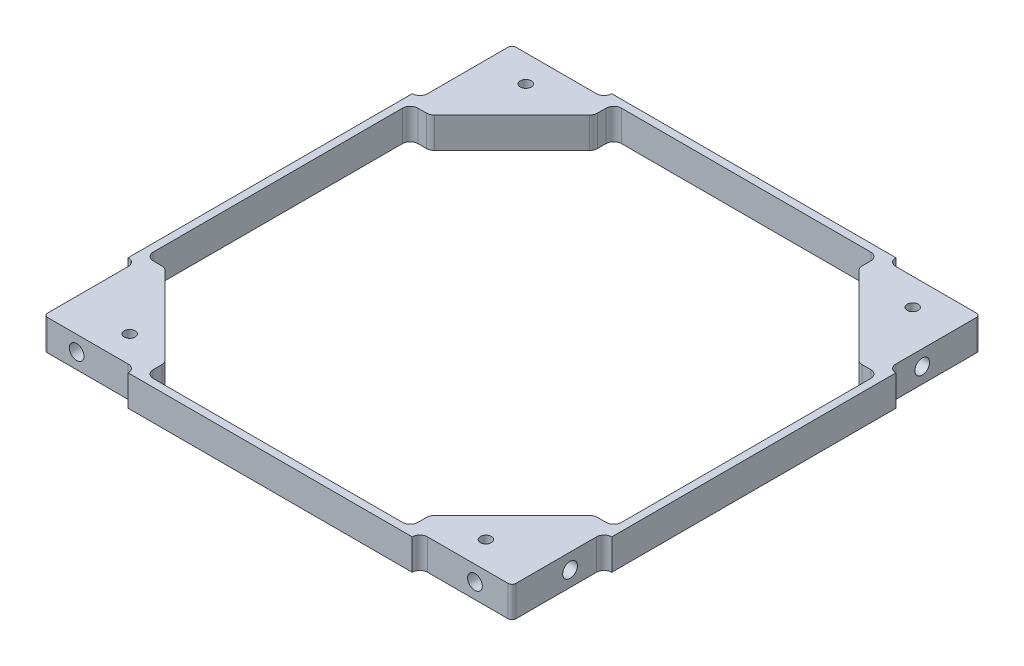
from build123d import *

# Parameters (mm, degrees)
BOSS_EXTRUDE2_DEPTH               = 6.35
FILLET7_R                         = 1.5875
FILLET8_R                         = 0.79
TAP_DRILL_FOR_4_HELICOIL5_D       = 3.048
TAP_DRILL_FOR_4_HELICOIL5_DEPTH   = 5.6896
TAP_DRILL_FOR_4_HELICOIL5_TIP     = 0.915711583
TAP_DRILL_FOR_4_HELICOIL5_2_D     = 3.048
TAP_DRILL_FOR_4_HELICOIL5_2_DEPTH = 5.6896
TAP_DRILL_FOR_4_HELICOIL5_2_TIP   = 0.915711583
FILLET10_R                        = 1.5875
TAP_DRILL_FOR_4_40_TAP1_D         = 2.2606
TAP_DRILL_FOR_4_40_TAP1_DEPTH     = 8.65
TAP_DRILL_FOR_4_40_TAP1_TIP       = 0.679152758
CHAMFER1_SIZE                     = 17
FILLET11_R                        = 1.5875
TAP_DRILL_FOR_4_HELICOIL6_D       = 3.048
TAP_DRILL_FOR_4_HELICOIL6_DEPTH   = 5.6896
TAP_DRILL_FOR_4_HELICOIL6_TIP     = 0.915711583
TAP_DRILL_FOR_4_HELICOIL7_D       = 3.048
TAP_DRILL_FOR_4_HELICOIL7_DEPTH   = 5.69
TAP_DRILL_FOR_4_HELICOIL7_TIP     = 0.915711583


with BuildPart() as part:
    # Sketch10 → Boss-Extrude2 (new body)
    with BuildSketch(Plane(origin=(0, 0, 0), x_dir=(1, 0, 0), z_dir=(0, 1, 0))):
        Polygon((48.415, -48.415), (29.365, -48.415), (29.365, -50), (-29.365, -50), (-29.365, -48.415), (-48.415, -48.415), (-48.415, -29.365), (-50, -29.365), (-50, 29.365), (-48.415, 29.365), (-48.415, 48.415), (-29.365, 48.415), (-29.365, 50), (29.365, 50), (29.365, 48.415), (48.415, 48.415), (48.415, 29.365), (50, 29.365), (50, -29.365), (48.415, -29.365), align=None)
        Polygon((27.365, 48.415), (-27.365, 48.415), (-27.365, 46.415), (-27.365, 27.365), (-46.415, 27.365), (-48.415, 27.365), (-48.415, -27.365), (-46.415, -27.365), (-27.365, -27.365), (-27.365, -46.415), (-27.365, -48.415), (27.365, -48.415), (27.365, -46.415), (27.365, -27.365), (46.415, -27.365), (48.415, -27.365), (48.415, 27.365), (46.415, 27.365), (27.365, 27.365), (27.365, 46.415), align=None, mode=Mode.SUBTRACT)
    extrude(amount=BOSS_EXTRUDE2_DEPTH)

    # Fillet7
    # the kernel refuses this fillet: 1.5875 mm, written as the material it adds along each edge
    with BuildSketch(Plane(origin=(-48.415, 0, 29.365), x_dir=(-1, 0, 0), z_dir=(0, 1, 0))) as fillet7_piece_1_section:
        with BuildLine():
            CenterArc((FILLET7_R, FILLET7_R), FILLET7_R, 180, 90)
            Line((0, FILLET7_R), (0, 0))
            Line((0, 0), (FILLET7_R, 0))
        make_face()
    fillet7_piece_1 = extrude(amount=6.35, mode=Mode.PRIVATE)
    fillet7_piece_1 = split(fillet7_piece_1, bisect_by=Plane(origin=(-50, 3.175, 29.724448602), z_dir=(1, 0, 0)), keep=Keep.TOP, mode=Mode.PRIVATE)
    add(fillet7_piece_1)
    with BuildSketch(Plane(origin=(-29.365, 0, 48.415), x_dir=(-1, 0, 0), z_dir=(0, 1, 0))) as fillet7_piece_2_section:
        with BuildLine():
            CenterArc((FILLET7_R, FILLET7_R), FILLET7_R, 180, 90)
            Line((0, FILLET7_R), (0, 0))
            Line((0, 0), (FILLET7_R, 0))
        make_face()
    fillet7_piece_2 = extrude(amount=6.35, mode=Mode.PRIVATE)
    fillet7_piece_2 = split(fillet7_piece_2, bisect_by=Plane(origin=(-29.724448602, 3.175, 50), z_dir=(0, 0, -1)), keep=Keep.TOP, mode=Mode.PRIVATE)
    add(fillet7_piece_2)
    with BuildSketch(Plane(origin=(29.365, 0, 48.415), x_dir=(1, 0, 0), z_dir=(0, 1, 0))) as fillet7_piece_3_section:
        with BuildLine():
            CenterArc((FILLET7_R, -FILLET7_R), FILLET7_R, 90, 90)
            Line((0, -FILLET7_R), (0, 0))
            Line((0, 0), (FILLET7_R, 0))
        make_face()
    fillet7_piece_3 = extrude(amount=6.35, mode=Mode.PRIVATE)
    fillet7_piece_3 = split(fillet7_piece_3, bisect_by=Plane(origin=(29.724448602, 3.175, 50), z_dir=(0, 0, -1)), keep=Keep.TOP, mode=Mode.PRIVATE)
    add(fillet7_piece_3)
    with BuildSketch(Plane(origin=(48.415, 0, 29.365), x_dir=(1, 0, 0), z_dir=(0, 1, 0))) as fillet7_piece_4_section:
        with BuildLine():
            CenterArc((FILLET7_R, -FILLET7_R), FILLET7_R, 90, 90)
            Line((0, -FILLET7_R), (0, 0))
            Line((0, 0), (FILLET7_R, 0))
        make_face()
    fillet7_piece_4 = extrude(amount=6.35, mode=Mode.PRIVATE)
    fillet7_piece_4 = split(fillet7_piece_4, bisect_by=Plane(origin=(50, 3.175, 29.724448602), z_dir=(-1, 0, 0)), keep=Keep.TOP, mode=Mode.PRIVATE)
    add(fillet7_piece_4)
    with BuildSketch(Plane(origin=(48.415, 0, -29.365), x_dir=(1, 0, 0), z_dir=(0, 1, 0))) as fillet7_piece_5_section:
        with BuildLine():
            CenterArc((FILLET7_R, FILLET7_R), FILLET7_R, 180, 90)
            Line((0, FILLET7_R), (0, 0))
            Line((0, 0), (FILLET7_R, 0))
        make_face()
    fillet7_piece_5 = extrude(amount=6.35, mode=Mode.PRIVATE)
    fillet7_piece_5 = split(fillet7_piece_5, bisect_by=Plane(origin=(50, 3.175, -29.724448602), z_dir=(-1, 0, 0)), keep=Keep.TOP, mode=Mode.PRIVATE)
    add(fillet7_piece_5)
    with BuildSketch(Plane(origin=(29.365, 0, -48.415), x_dir=(1, 0, 0), z_dir=(0, 1, 0))) as fillet7_piece_6_section:
        with BuildLine():
            CenterArc((FILLET7_R, FILLET7_R), FILLET7_R, 180, 90)
            Line((0, FILLET7_R), (0, 0))
            Line((0, 0), (FILLET7_R, 0))
        make_face()
    fillet7_piece_6 = extrude(amount=6.35, mode=Mode.PRIVATE)
    fillet7_piece_6 = split(fillet7_piece_6, bisect_by=Plane(origin=(29.724448602, 3.175, -50), z_dir=(0, 0, 1)), keep=Keep.TOP, mode=Mode.PRIVATE)
    add(fillet7_piece_6)
    with BuildSketch(Plane(origin=(-48.415, 0, -29.365), x_dir=(0, 0, -1), z_dir=(0, 1, 0))) as fillet7_piece_7_section:
        with BuildLine():
            CenterArc((FILLET7_R, FILLET7_R), FILLET7_R, 180, 90)
            Line((0, FILLET7_R), (0, 0))
            Line((0, 0), (FILLET7_R, 0))
        make_face()
    fillet7_piece_7 = extrude(amount=6.35, mode=Mode.PRIVATE)
    fillet7_piece_7 = split(fillet7_piece_7, bisect_by=Plane(origin=(-50, 3.175, -29.724448602), z_dir=(1, 0, 0)), keep=Keep.TOP, mode=Mode.PRIVATE)
    add(fillet7_piece_7)
    with BuildSketch(Plane(origin=(-29.365, 0, -48.415), x_dir=(0, 0, -1), z_dir=(0, 1, 0))) as fillet7_piece_8_section:
        with BuildLine():
            CenterArc((FILLET7_R, FILLET7_R), FILLET7_R, 180, 90)
            Line((0, FILLET7_R), (0, 0))
            Line((0, 0), (FILLET7_R, 0))
        make_face()
    fillet7_piece_8 = extrude(amount=6.35, mode=Mode.PRIVATE)
    fillet7_piece_8 = split(fillet7_piece_8, bisect_by=Plane(origin=(-29.724448602, 3.175, -50), z_dir=(0, 0, 1)), keep=Keep.TOP, mode=Mode.PRIVATE)
    add(fillet7_piece_8)

    # Fillet8
    fillet8_edges = [part.edges().sort_by_distance(p)[0] for p in [
        (-48.415, 3.175, -48.415),
        (48.415, 3.175, -48.415),
        (48.415, 3.175, 48.415),
        (-48.415, 3.175, 48.415),
    ]]
    fillet(fillet8_edges, radius=FILLET8_R)

    # Tap Drill for _4 Helicoil5
    with Locations(Plane(origin=(48.415, 0, 0), x_dir=(0, 0, -1), z_dir=(1, 0, 0))):
        with Locations((-36.415, 3.175), (36.415, 3.175)):
            Hole(TAP_DRILL_FOR_4_HELICOIL5_D / 2, depth=TAP_DRILL_FOR_4_HELICOIL5_DEPTH)
            with Locations((0, 0, -(TAP_DRILL_FOR_4_HELICOIL5_DEPTH + TAP_DRILL_FOR_4_HELICOIL5_TIP / 2))):  # 118° drill point
                Cone(0, TAP_DRILL_FOR_4_HELICOIL5_D / 2, TAP_DRILL_FOR_4_HELICOIL5_TIP, mode=Mode.SUBTRACT)

    # Tap Drill for _4 Helicoil5 2
    with Locations(Plane.XY.offset(48.415)):
        with Locations((40.755, 3.175), (-41.615, 3.175)):
            Hole(TAP_DRILL_FOR_4_HELICOIL5_2_D / 2, depth=TAP_DRILL_FOR_4_HELICOIL5_2_DEPTH)
            with Locations((0, 0, -(TAP_DRILL_FOR_4_HELICOIL5_2_DEPTH + TAP_DRILL_FOR_4_HELICOIL5_2_TIP / 2))):  # 118° drill point
                Cone(0, TAP_DRILL_FOR_4_HELICOIL5_2_D / 2, TAP_DRILL_FOR_4_HELICOIL5_2_TIP, mode=Mode.SUBTRACT)

    # Fillet10
    fillet10_edges = [part.edges().sort_by_distance(p)[0] for p in [
        (27.365, 3.175, -48.415),
        (-27.365, 3.175, -48.415),
        (-48.415, 3.175, -27.365),
        (-48.415, 3.175, 27.365),
        (-27.365, 3.175, 48.415),
        (27.365, 3.175, 48.415),
        (48.415, 3.175, 27.365),
        (48.415, 3.175, -27.365),
    ]]
    fillet(fillet10_edges, radius=FILLET10_R)

    # Tap Drill for #4-40 Tap1
    with Locations(Plane(origin=(0, 6.35, 0), x_dir=(1, 0, 0), z_dir=(0, 1, 0))):
        with Locations((37.465, -42.8625), (40.005, 42.8625), (-40.005, 42.8625), (-36.195, -42.8625)):
            Hole(TAP_DRILL_FOR_4_40_TAP1_D / 2, depth=TAP_DRILL_FOR_4_40_TAP1_DEPTH)
            with Locations((0, 0, -(TAP_DRILL_FOR_4_40_TAP1_DEPTH + TAP_DRILL_FOR_4_40_TAP1_TIP / 2))):  # 118° drill point
                Cone(0, TAP_DRILL_FOR_4_40_TAP1_D / 2, TAP_DRILL_FOR_4_40_TAP1_TIP, mode=Mode.SUBTRACT)

    # Chamfer1
    chamfer1_edges = [part.edges().sort_by_distance(p)[0] for p in [
        (27.365, 3.175, -27.365),
        (-27.365, 3.175, -27.365),
        (-27.365, 3.175, 27.365),
        (27.365, 3.175, 27.365),
    ]]
    chamfer(chamfer1_edges, length=CHAMFER1_SIZE)

    # Fillet11
    fillet11_edges = [part.edges().sort_by_distance(p)[0] for p in [
        (-44.365, 3.175, 27.365),
        (-27.365, 3.175, 44.365),
        (27.365, 3.175, 44.365),
        (44.365, 3.175, 27.365),
        (-27.365, 3.175, -44.365),
        (-44.365, 3.175, -27.365),
        (44.365, 3.175, -27.365),
        (27.365, 3.175, -44.365),
    ]]
    fillet(fillet11_edges, radius=FILLET11_R)

    # Tap Drill for #4 Helicoil6
    with Locations(Plane(origin=(0, 0, -48.415), x_dir=(-1, 0, 0), z_dir=(0, 0, -1))):
        with Locations((36.415, 3.175), (-36.415, 3.175)):
            Hole(TAP_DRILL_FOR_4_HELICOIL6_D / 2, depth=TAP_DRILL_FOR_4_HELICOIL6_DEPTH)
            with Locations((0, 0, -(TAP_DRILL_FOR_4_HELICOIL6_DEPTH + TAP_DRILL_FOR_4_HELICOIL6_TIP / 2))):  # 118° drill point
                Cone(0, TAP_DRILL_FOR_4_HELICOIL6_D / 2, TAP_DRILL_FOR_4_HELICOIL6_TIP, mode=Mode.SUBTRACT)

    # Tap Drill for #4 Helicoil7
    with Locations(Plane.ZY.offset(48.415)):
        with Locations((-36.415, 3.175), (36.415, 3.175)):
            Hole(TAP_DRILL_FOR_4_HELICOIL7_D / 2, depth=TAP_DRILL_FOR_4_HELICOIL7_DEPTH)
            with Locations((0, 0, -(TAP_DRILL_FOR_4_HELICOIL7_DEPTH + TAP_DRILL_FOR_4_HELICOIL7_TIP / 2))):  # 118° drill point
                Cone(0, TAP_DRILL_FOR_4_HELICOIL7_D / 2, TAP_DRILL_FOR_4_HELICOIL7_TIP, mode=Mode.SUBTRACT)


solid = part.part
